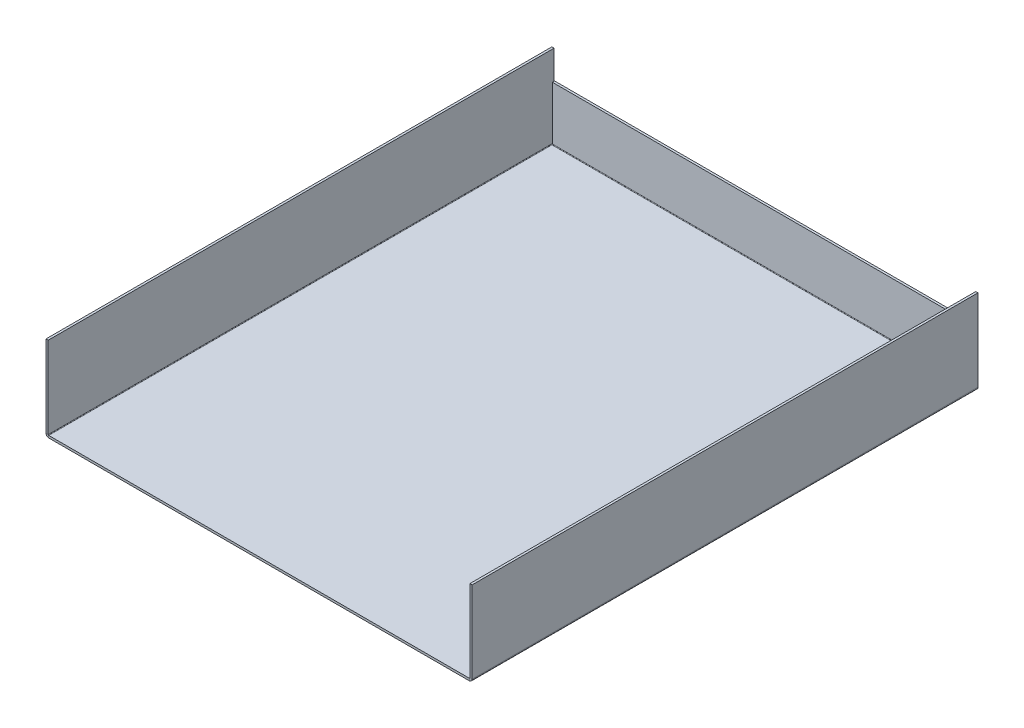
from build123d import *

# Parameters (mm, degrees)
BASE_FLANGE1_DEPTH           = 720
EDGE_FLANGE1_STRIP_W         = 14.1732
EDGE_FLANGE1_STRIP_H         = 3.175
EDGE_FLANGE1_STRIP_CUT_DEPTH = 598.5268
EDGE_FLANGE1_DEPTH           = 598.5268


# Sheet-metal steps are written as plain solids
with BuildPart() as part:
    # Sketch1 → Base-Flange1 (new body)
    with BuildSketch(Plane.XY):
        with BuildLine():
            Line((-300, 117), (-300, 0.7366))
            ThreePointArc((-300, 0.7366), (-299.784254855, 0.215745145), (-299.2634, 0))
            Line((-299.2634, 0), (299.2634, 0))
            ThreePointArc((299.2634, 0), (299.784254855, 0.215745145), (300, 0.7366))
            Line((300, 0.7366), (300, 117))
            Line((300, 117), (303.175, 117))
            Line((303.175, 117), (303.175, 0.7366))
            ThreePointArc((303.175, 0.7366), (302.029318885, -2.029318885), (299.2634, -3.175))
            Line((299.2634, -3.175), (-299.2634, -3.175))
            ThreePointArc((-299.2634, -3.175), (-302.029318885, -2.029318885), (-303.175, 0.7366))
            Line((-303.175, 0.7366), (-303.175, 117))
            Line((-303.175, 117), (-300, 117))
        make_face()
    extrude(amount=BASE_FLANGE1_DEPTH)

    # Edge-Flange1 strip (across the edge) → Edge-Flange1 strip cut (cut)
    with BuildSketch(Plane.ZY.offset(-299.2634)):
        with Locations((-3.175, -1.5875)):
            Rectangle(EDGE_FLANGE1_STRIP_W, EDGE_FLANGE1_STRIP_H)
    extrude(amount=EDGE_FLANGE1_STRIP_CUT_DEPTH, mode=Mode.SUBTRACT)

    # Edge-Flange1 section (across the edge) → Edge-Flange1 (add)
    with BuildSketch(Plane.ZY.offset(-299.2634)):
        with BuildLine():
            Line((0, 0.7366), (0, 76.825))
            Line((0, 76.825), (3.175, 76.825))
            Line((3.175, 76.825), (3.175, 0.7366))
            ThreePointArc((3.175, 0.7366), (3.390745145, 0.215745145), (3.9116, 0))
            Line((3.9116, 0), (3.9116, -3.175))
            ThreePointArc((3.9116, -3.175), (1.145681115, -2.029318885), (0, 0.7366))
        make_face()
    extrude(amount=EDGE_FLANGE1_DEPTH)


solid = part.part
